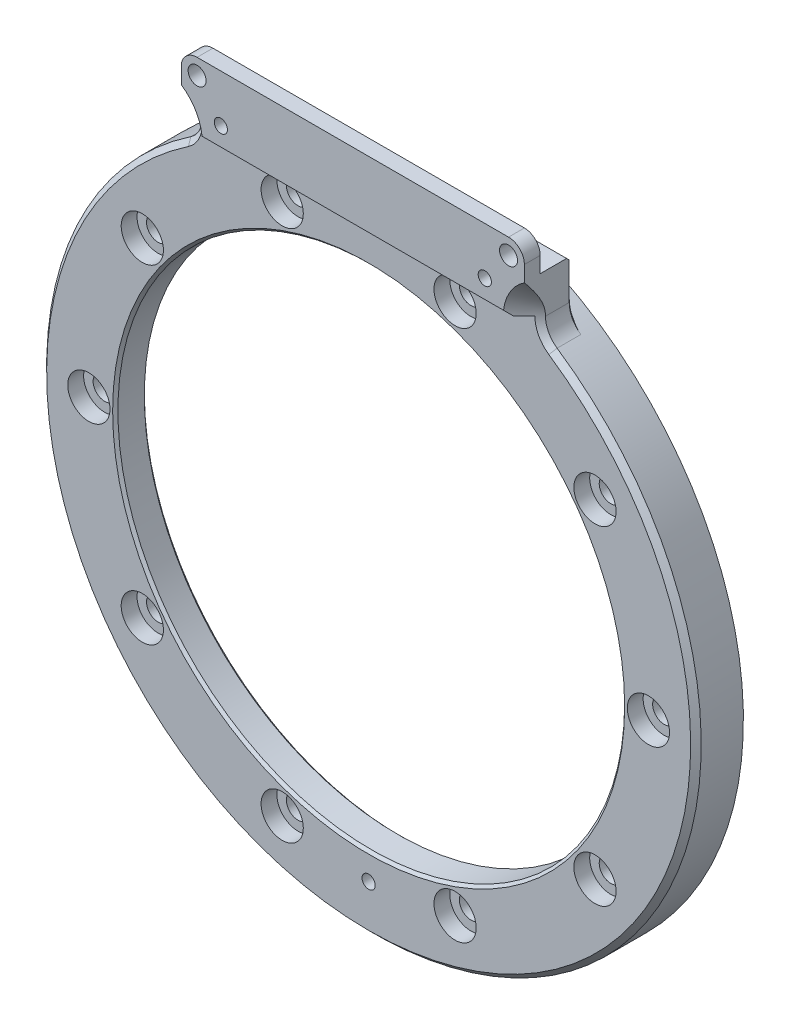
from build123d import *

# Parameters (mm, degrees)
SKETCH_1_R             = 62
SKETCH_1_R_2           = 60
EXTRUDE_1_DEPTH        = 3
EXTRUDE_START          = 6
SKETCH_2_R             = 48
EXTRUDE_2_DEPTH        = 6
FILLET_1_R             = 5
CHAMFER_1_SIZE         = 0.5
CHAMFER_2_SIZE         = 0.5
SKETCH_6_R             = 2.2
CUT_EXTRUDE_1_DEPTH    = 6
SKETCH_7_W             = 65
SKETCH_7_H             = 13.477482046
EXTRUDE_3_DEPTH        = 3
SKETCH_11_R            = 1.7
CUT_EXTRUDE_2_DEPTH    = 3
CHAMFER_3_SIZE         = 1
CHAMFER_4_SIZE         = 1
FILLET_2_R             = 3
CHAMFER_5_3_ANGLE      = 291.929687
SKETCH_12_R            = 4
CUT_EXTRUDE_3_DEPTH    = 3
CUT_EXTRUDE_4_DEPTH    = 2
CHAMFER_6_SIZE         = 1
HOLE_WIZARD_M3_1_D     = 2.5
HOLE_WIZARD_M3_1_DEPTH = 7.5
HOLE_WIZARD_M3_1_TIP   = 0.751075774
HOLE_WIZARD_M3_2_D     = 2.5
HOLE_WIZARD_M3_2_DEPTH = 7.5
HOLE_WIZARD_M3_2_TIP   = 0.751075774


with BuildPart() as part:
    # 草图1 → 凸台-拉伸1 (new body)
    with BuildSketch(Plane.XY):
        Circle(SKETCH_1_R)
        Circle(SKETCH_1_R_2, mode=Mode.SUBTRACT)
    extrude(amount=-EXTRUDE_1_DEPTH)

    # 草图2 → 凸台-拉伸2 (add)
    with BuildSketch(Plane.XY.offset(EXTRUDE_START)):
        with BuildLine():
            Line((-32.5, 63), (32.5, 63))
            Line((32.5, 63), (32.5, 52.79914772))
            ThreePointArc((32.5, 52.79914772), (0, -62), (-32.5, 52.79914772))
            Line((-32.5, 52.79914772), (-32.5, 63))
        make_face()
        Circle(SKETCH_2_R, mode=Mode.SUBTRACT)
    extrude(amount=-EXTRUDE_2_DEPTH)

    # 圆角1
    # the kernel refuses this fillet: 5 mm, written as the material it adds along each edge
    with BuildSketch(Plane(origin=(32.5, 52.79914772, 6), x_dir=(0.8403342947446245, -0.5420685132675156, 0), z_dir=(0, 0, -1))) as fillet_1_piece_1:
        with BuildLine():
            CenterArc((2.72541822, -4.998883971), FILLET_1_R, 91.210593649, 55.964843523)
            Line((-1.476253254, -2.288541405), (0, 0))
            ThreePointArc((0, 0), (1.309890927, -0.013838756), (2.619781855, 0))
        make_face()
    extrude(amount=6)
    with BuildSketch(Plane(origin=(-32.5, 52.79914772, 6), x_dir=(-0.840334294744627, -0.5420685132675117, 0), z_dir=(0, 0, -1))) as fillet_1_piece_2:
        with BuildLine():
            CenterArc((2.72541822, 4.998883971), FILLET_1_R, 212.824562828, 55.964843523)
            Line((-1.476253254, 2.288541405), (0, 0))
            ThreePointArc((0, 0), (1.309890927, 0.013838756), (2.619781855, 0))
        make_face()
    extrude(amount=6)

    # 倒角1
    chamfer_1_edges = [part.edges().sort_by_distance(p)[0] for p in [
        (-48, 0, 0),
        (-48, 0, 6),
        (-60, 0, -3),
    ]]
    chamfer(chamfer_1_edges, length=CHAMFER_1_SIZE)

    # 倒角2
    # the kernel refuses this chamfer: 0.5 mm, written as the material it takes off along each edge
    with BuildSketch(Plane(origin=(-32.5, 55.522517954, 0), x_dir=(0, 0, 1), z_dir=(0, 1, 0)), Plane(origin=(32.5, 64.285841494, 0), x_dir=(0, 0, 1), z_dir=(0, -1, 0))) as chamfer_2_piece_1:
        Polygon((CHAMFER_2_SIZE, 0), (0, CHAMFER_2_SIZE), (0, 0), align=None)
    extrude(amount=8.76332354, mode=Mode.SUBTRACT)
    with BuildSketch(Plane(origin=(37.5, 55.522517954, 0), x_dir=(-0.15613015555825177, -0.9877364904291813, 0), z_dir=(0.9877364904291813, -0.15613015555825177, 0))) as chamfer_2_piece_2_section:
        Polygon((5, -CHAMFER_2_SIZE), (5 + CHAMFER_2_SIZE, 0), (5, 0), align=None)
    chamfer_2_piece_2 = revolve(axis=Axis((37.5, 55.522517954, 0), (0, 0, -1)), revolution_arc=81.017652556, mode=Mode.PRIVATE)
    chamfer_2_piece_2 = chamfer_2_piece_2 - Plane(origin=(0, 0, 0), x_dir=(1, 0, 0), z_dir=(0, 0, 1)) * Cylinder(62, 22, mode=Mode.PRIVATE)
    add(chamfer_2_piece_2, mode=Mode.SUBTRACT)
    with BuildSketch(Plane(origin=(-37.5, 55.522517954, 0), x_dir=(1, 0, 0), z_dir=(0, 1, 0))) as chamfer_2_piece_3_section:
        Polygon((5, -CHAMFER_2_SIZE), (5 + CHAMFER_2_SIZE, 0), (5, 0), align=None)
    chamfer_2_piece_3 = revolve(axis=Axis((-37.5, 55.522517954, 0), (0, 0, -1)), revolution_arc=81.017652556, mode=Mode.PRIVATE)
    chamfer_2_piece_3 = chamfer_2_piece_3 - Plane(origin=(0, 0, 0), x_dir=(1, 0, 0), z_dir=(0, 0, 1)) * Cylinder(62, 22, mode=Mode.PRIVATE)
    add(chamfer_2_piece_3, mode=Mode.SUBTRACT)

    # 草图6 → 切除-拉伸1 (cut)
    with BuildSketch(Plane(origin=(0, 0, 0), x_dir=(-1, 0, 0), z_dir=(0, 0, -1))):
        with Locations((-42.877900702, 31.152618372)):
            Circle(SKETCH_6_R)
        with Locations((-53, 0)):
            Circle(SKETCH_6_R)
        with Locations((-42.877900702, -31.152618371)):
            Circle(SKETCH_6_R)
        with Locations((-16.377900702, -50.405995364)):
            Circle(SKETCH_6_R)
        with Locations((16.377900702, -50.405995364)):
            Circle(SKETCH_6_R)
        with Locations((42.877900702, -31.152618371)):
            Circle(SKETCH_6_R)
        with Locations((53, 0)):
            Circle(SKETCH_6_R)
        with Locations((42.877900702, 31.152618372)):
            Circle(SKETCH_6_R)
        with Locations((16.377900702, 50.405995364)):
            Circle(SKETCH_6_R)
        with Locations((-16.377900702, 50.405995364)):
            Circle(SKETCH_6_R)
    extrude(amount=-CUT_EXTRUDE_1_DEPTH, mode=Mode.SUBTRACT)

    # 草图7 → 凸台-拉伸3 (add)
    with BuildSketch(Plane.XY.offset(6)):
        with Locations((0, 62.261258977)):
            Rectangle(SKETCH_7_W, SKETCH_7_H)
    extrude(amount=EXTRUDE_3_DEPTH)

    # 草图11 → 切除-拉伸2 (cut)
    with BuildSketch(Plane.XY.offset(9)):
        with Locations((-29.5, 66)):
            Circle(SKETCH_11_R)
        with Locations((29.5, 66)):
            Circle(SKETCH_11_R)
    extrude(amount=-CUT_EXTRUDE_2_DEPTH, mode=Mode.SUBTRACT)

    # 倒角3
    chamfer_3_edges = [part.edges().sort_by_distance(p)[0] for p in [
        (0, 63, 0),
    ]]
    chamfer(chamfer_3_edges, length=CHAMFER_3_SIZE - 0.0001)  # a hair under: the kernel refuses the full size

    # 倒角4
    chamfer_4_edges = [part.edges().sort_by_distance(p)[0] for p in [
        (0, 55.522517954, 9),
    ]]
    chamfer(chamfer_4_edges, length=CHAMFER_4_SIZE)

    # 圆角2
    fillet_2_edges = [part.edges().sort_by_distance(p)[0] for p in [
        (-32.5, 69, 7.5),
        (32.5, 69, 7.5),
    ]]
    fillet(fillet_2_edges, radius=FILLET_2_R)

    # 倒角5: read off the stored shape, not the designer's step
    # 倒角5 outline → 倒角5 (revolve, cut)
    with BuildSketch(Plane(origin=(37.5, 55.522517954, 0), x_dir=(1, 0, 0), z_dir=(0, -1, 0))):
        Polygon((4.999998721, 9), (4.999998721, 4.999998721), (9, 9), align=None)
    revolve(axis=Axis((37.5, 55.522517954, 0), (0, 0, 1)), mode=Mode.SUBTRACT)

    # Chamfer 5 2 outline → Chamfer 5 2 (revolve, cut)
    with BuildSketch(Plane(origin=(-37.5, 55.522517954, 0), x_dir=(1, 0, 0), z_dir=(0, -1, 0))):
        Polygon((4.99999762, 9), (4.99999762, 4.99999762), (9, 9), align=None)
    revolve(axis=Axis((-37.5, 55.522517954, 0), (0, 0, 1)), mode=Mode.SUBTRACT)

    # Chamfer 5 3 outline → Chamfer 5 3 (revolve, cut)
    with BuildSketch(Plane(origin=(0, 0, 0), x_dir=(-0.5597014925373135, 0.8286942978273132, 0), z_dir=(0.8286942978273132, 0.5597014925373135, 0))):
        Polygon((62, 6), (61, 6), (62, 5), align=None)
    revolve(axis=Axis((0, 0, 0), (0, 0, 1)), revolution_arc=CHAMFER_5_3_ANGLE, mode=Mode.SUBTRACT)

    # 草图12 → 切除-拉伸3 (cut)
    with BuildSketch(Plane.XY.offset(6)):
        with Locations((-16.377900702, 50.405995364)):
            Circle(SKETCH_12_R)
        with Locations((16.377900702, 50.405995364)):
            Circle(SKETCH_12_R)
        with Locations((42.877900702, 31.152618372)):
            Circle(SKETCH_12_R)
        with Locations((53, 0)):
            Circle(SKETCH_12_R)
        with Locations((42.877900702, -31.152618371)):
            Circle(SKETCH_12_R)
        with Locations((16.377900702, -50.405995364)):
            Circle(SKETCH_12_R)
        with Locations((-16.377900702, -50.405995364)):
            Circle(SKETCH_12_R)
        with Locations((-42.877900702, -31.152618371)):
            Circle(SKETCH_12_R)
        with Locations((-53, 0)):
            Circle(SKETCH_12_R)
        with Locations((-42.877900702, 31.152618372)):
            Circle(SKETCH_12_R)
    extrude(amount=-CUT_EXTRUDE_3_DEPTH, mode=Mode.SUBTRACT)

    # 草图14 → 切除-拉伸4 (cut)
    with BuildSketch(Plane(origin=(0, 63, 0), x_dir=(1, 0, 0), z_dir=(0, 1, 0))):
        with BuildLine():
            ThreePointArc((-4.030108666, 3.809429698), (-11.733833556, 7.447967709), (-11.5, -1.068584287))
            ThreePointArc((-11.5, -1.068584287), (0, -4.15), (11.5, -1.068584287))
            ThreePointArc((11.5, -1.068584287), (11.733833556, 7.447967709), (4.030108666, 3.809429698))
            ThreePointArc((4.030108666, 3.809429698), (0, 5.85), (-4.030108666, 3.809429698))
        make_face()
    extrude(amount=-CUT_EXTRUDE_4_DEPTH, mode=Mode.SUBTRACT)

    # 倒角6
    # the kernel refuses this chamfer: 1 mm, written as the material it takes off along each edge
    with BuildSketch(Plane(origin=(18.80558547, 61, -3), x_dir=(0, -1, 0), z_dir=(-1, 0, 0))) as chamfer_6_piece_1:
        Polygon((CHAMFER_6_SIZE, 0), (0, CHAMFER_6_SIZE), (0, 0), align=None)
    extrude(amount=37.61117094, mode=Mode.SUBTRACT)
    with BuildSketch(Plane(origin=(-9, 63, -3.261542732), x_dir=(-0.874686173337968, 0, 0.48468969266055384), z_dir=(-0.48468969266055384, 0, -0.874686173337968))) as chamfer_6_piece_2:
        Polygon((5, -CHAMFER_6_SIZE), (5 + CHAMFER_6_SIZE, 0), (5, 0), align=None)
    revolve(axis=Axis((-9, 63, -3.261542732), (0, 1, 0)), revolution_arc=31.007856081, mode=Mode.SUBTRACT)
    with BuildSketch(Plane(origin=(9, 63, -3.261542732), x_dir=(0.49999999999998873, 0, 0.8660254037844451), z_dir=(-0.8660254037844451, 0, 0.49999999999998873))) as chamfer_6_piece_3:
        Polygon((5, -CHAMFER_6_SIZE), (5 + CHAMFER_6_SIZE, 0), (5, 0), align=None)
    revolve(axis=Axis((9, 63, -3.261542732), (0, 1, 0)), revolution_arc=31.007856081, mode=Mode.SUBTRACT)
    with BuildSketch(Plane(origin=(0, 63, -18.85), x_dir=(-0.500000000000001, 0, 0.8660254037844382), z_dir=(-0.8660254037844382, 0, -0.500000000000001))) as chamfer_6_piece_4:
        Polygon((23, -CHAMFER_6_SIZE), (23 + CHAMFER_6_SIZE, 0), (23, 0), align=None)
    revolve(axis=Axis((0, 63, -18.85), (0, 1, 0)), revolution_arc=60, mode=Mode.SUBTRACT)

    # M3 螺纹孔1
    with Locations(Plane.XY.offset(9)):
        with Locations((-25, 60), (25, 60)):
            Hole(HOLE_WIZARD_M3_1_D / 2, depth=HOLE_WIZARD_M3_1_DEPTH)
            with Locations((0, 0, -(HOLE_WIZARD_M3_1_DEPTH + HOLE_WIZARD_M3_1_TIP / 2))):  # 118° drill point
                Cone(0, HOLE_WIZARD_M3_1_D / 2, HOLE_WIZARD_M3_1_TIP, mode=Mode.SUBTRACT)

    # M3 螺纹孔2
    with Locations(Plane.XY.offset(6)):
        with Locations((0, -53)):
            Hole(HOLE_WIZARD_M3_2_D / 2, depth=HOLE_WIZARD_M3_2_DEPTH)
            with Locations((0, 0, -(HOLE_WIZARD_M3_2_DEPTH + HOLE_WIZARD_M3_2_TIP / 2))):  # 118° drill point
                Cone(0, HOLE_WIZARD_M3_2_D / 2, HOLE_WIZARD_M3_2_TIP, mode=Mode.SUBTRACT)


solid = part.part
